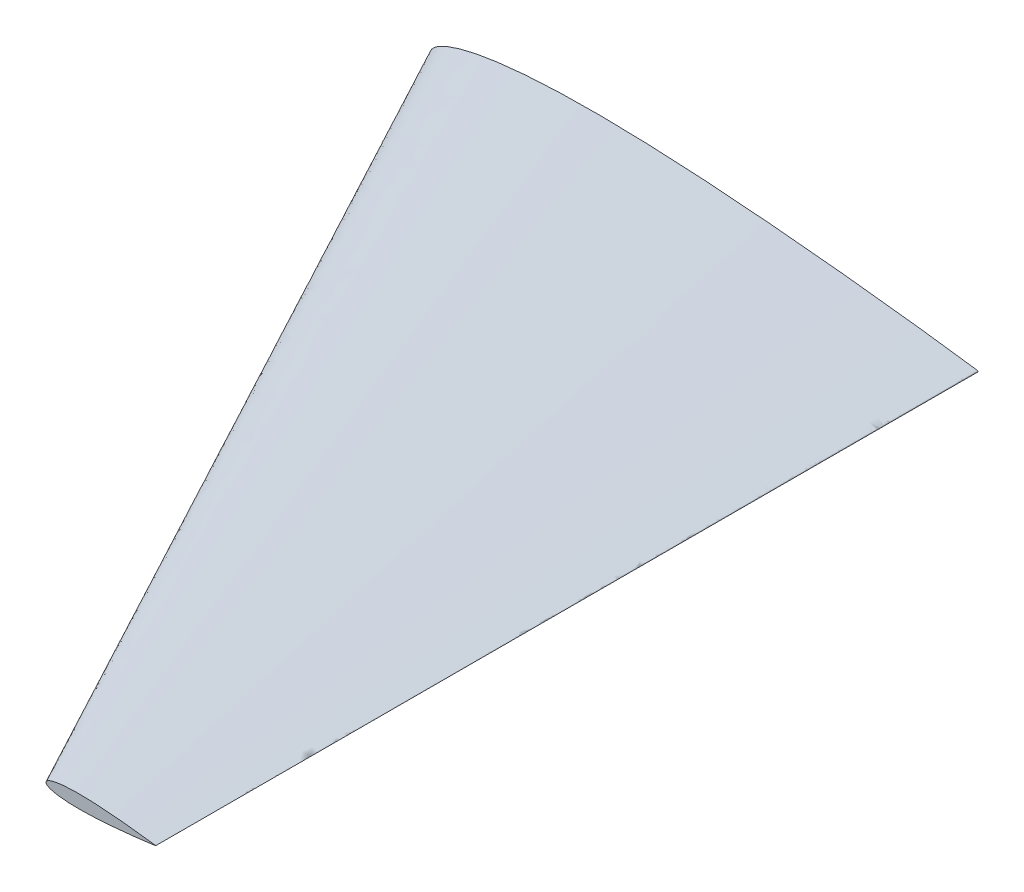
from build123d import *

# Parameters (mm, degrees)
SKETCH4_R          = 3
CUT_EXTRUDE3_DEPTH = 40


with BuildPart() as part:
    # Sketch2 for Loft3 → Loft3 section 0
    with BuildSketch(Plane(origin=(0, 0, 0), x_dir=(0, 1, 0), z_dir=(0, 0, 1))):
        with BuildLine():
            # circular arc as an exact rational Bezier (weights 1, cos(half-angle), 1)
            Bezier((-0.1134, -90), (0, -90.808630182), (0.1134, -90), weights=[1, 0.138878188, 1])
            add(Edge.make_bspline(
                [(0.1134, -90), (0.119883103, -89.953770434), (0.145780197, -89.769104014), (0.203559317, -89.354670505), (0.29903625, -88.666808737), (0.43002961, -87.709721874), (0.595034667, -86.48935693), (0.790717945, -85.013174411), (1.014447537, -83.290291495), (1.262704812, -81.331354624), (1.532156619, -79.148419388), (1.81883068, -76.754947135), (2.119272922, -74.165710303), (2.429361956, -71.396635047), (2.745321108, -68.464808853), (3.063223397, -65.388326514), (3.378966278, -62.186148552), (3.688117442, -58.878026055), (3.986618437, -55.484331913), (4.269478842, -52.026026469), (4.532086612, -48.524359499), (4.769566223, -45.000951756), (4.976952181, -41.477512363), (5.149005142, -37.975732412), (5.281137154, -34.517238785), (5.369037574, -31.123254472), (5.408413012, -27.814753604), (5.396138618, -24.61206555), (5.329843493, -21.534935718), (5.207847127, -18.602305244), (5.029830398, -15.832225033), (4.796328946, -13.241720098), (4.509166427, -10.846642485), (4.17078617, -8.66159096), (3.784722266, -6.699806407), (3.355340044, -4.972787114), (2.886826516, -3.490346755), (2.383545234, -2.260017099), (1.848901134, -1.285721701), (1.281838991, -0.568959771), (0.668640285, -0.109879586), (0, 0.051207794), (-0.668640285, -0.109879586), (-1.281838991, -0.568959771), (-1.848901134, -1.285721701), (-2.383545234, -2.260017099), (-2.886826516, -3.490346755), (-3.355340044, -4.972787114), (-3.784722266, -6.699806407), (-4.17078617, -8.66159096), (-4.509166427, -10.846642485), (-4.796328946, -13.241720098), (-5.029830398, -15.832225033), (-5.207847127, -18.602305244), (-5.329843493, -21.534935718), (-5.396138618, -24.61206555), (-5.408413012, -27.814753604), (-5.369037574, -31.123254472), (-5.281137154, -34.517238785), (-5.149005142, -37.975732412), (-4.976952181, -41.477512363), (-4.769566223, -45.000951756), (-4.532086612, -48.524359499), (-4.269478842, -52.026026469), (-3.986618437, -55.484331913), (-3.688117442, -58.878026055), (-3.378966278, -62.186148552), (-3.063223397, -65.388326514), (-2.745321108, -68.464808853), (-2.429361956, -71.396635047), (-2.119272922, -74.165710303), (-1.81883068, -76.754947135), (-1.532156619, -79.148419388), (-1.262704812, -81.331354624), (-1.014447537, -83.290291495), (-0.790717945, -85.013174411), (-0.595034667, -86.48935693), (-0.43002961, -87.709721874), (-0.29903625, -88.666808737), (-0.203559317, -89.354670505), (-0.145780197, -89.769104014), (-0.119883103, -89.953770434), (-0.1134, -90)],
                knots=[0, 0, 0, 0, 0.000763157, 0.003048469, 0.00684069, 0.012116132, 0.018840792, 0.02697275, 0.036459854, 0.047242945, 0.059253555, 0.072417264, 0.086651022, 0.101866322, 0.117968955, 0.134857919, 0.152428309, 0.170571841, 0.189174522, 0.208122338, 0.227296649, 0.24658007, 0.265853108, 0.284996761, 0.303895242, 0.322432581, 0.340498659, 0.357984483, 0.374788114, 0.390812303, 0.405965006, 0.420162443, 0.433328265, 0.445393603, 0.456301171, 0.466003881, 0.474472001, 0.481696232, 0.487703698, 0.492583405, 0.496543603, 0.5, 0.503456397, 0.507416595, 0.512296302, 0.518303768, 0.525527999, 0.533996119, 0.543698829, 0.554606397, 0.566671735, 0.579837557, 0.594034994, 0.609187697, 0.625211886, 0.642015517, 0.659501341, 0.677567419, 0.696104758, 0.715003239, 0.734146892, 0.75341993, 0.772703351, 0.791877662, 0.810825478, 0.829428159, 0.847571691, 0.865142081, 0.882031045, 0.898133678, 0.913348978, 0.927582736, 0.940746445, 0.952757055, 0.963540146, 0.97302725, 0.981159208, 0.987883868, 0.99315931, 0.996951531, 0.999236843, 1, 1, 1, 1], degree=3))
        make_face()
    # Sketch3 for Loft3 → Loft3 section 1
    with BuildSketch(Plane(origin=(0, 0, 135), x_dir=(0, 1, 0), z_dir=(0, 0, 1))):
        with BuildLine():
            Bezier((-0.02268, -89.987277685), (0, -90.14900372), (0.02268, -89.987277685), weights=[1, 0.138878188, 1])
            add(Edge.make_bspline(
                [(0.02268, -89.987277685), (0.023976621, -89.978031772), (0.029156039, -89.941098488), (0.040711863, -89.858211786), (0.05980725, -89.720639432), (0.086005922, -89.52922206), (0.119006933, -89.285149071), (0.158143589, -88.989912567), (0.202889507, -88.645335984), (0.252540962, -88.25354861), (0.306431324, -87.816961562), (0.363766136, -87.338267112), (0.423854584, -86.820419745), (0.485872391, -86.266604694), (0.549064222, -85.680239456), (0.612644679, -85.064942988), (0.675793256, -84.424507395), (0.759192361, -83.532081652), (0.836875781, -82.61943105), (0.906417322, -81.692149585), (0.953913245, -80.987468036), (0.995390436, -80.282780157), (1.029801028, -79.582424167), (1.056227431, -78.890725442), (1.073807515, -78.211928579), (1.081682602, -77.550228406), (1.079227724, -76.909690795), (1.065968699, -76.294264828), (1.041569425, -75.707738734), (1.00596608, -75.153722691), (0.959265789, -74.635621704), (0.901833285, -74.156606182), (0.834157234, -73.719595877), (0.756944453, -73.327238966), (0.671068009, -72.981835108), (0.577365303, -72.685347036), (0.476709047, -72.439281105), (0.369780227, -72.244422025), (0.256367798, -72.101069639), (0.133728057, -72.009253602), (0, -71.977036126), (-0.133728057, -72.009253602), (-0.256367798, -72.101069639), (-0.369780227, -72.244422025), (-0.476709047, -72.439281105), (-0.577365303, -72.685347036), (-0.671068009, -72.981835108), (-0.756944453, -73.327238966), (-0.834157234, -73.719595877), (-0.901833285, -74.156606182), (-0.959265789, -74.635621704), (-1.00596608, -75.153722691), (-1.041569425, -75.707738734), (-1.065968699, -76.294264828), (-1.079227724, -76.909690795), (-1.081682602, -77.550228406), (-1.073807515, -78.211928579), (-1.056227431, -78.890725442), (-1.029801028, -79.582424167), (-0.995390436, -80.282780157), (-0.953913245, -80.987468036), (-0.906417322, -81.692149585), (-0.836875781, -82.61943105), (-0.759192361, -83.532081652), (-0.675793256, -84.424507395), (-0.612644679, -85.064942988), (-0.549064222, -85.680239456), (-0.485872391, -86.266604694), (-0.423854584, -86.820419745), (-0.363766136, -87.338267112), (-0.306431324, -87.816961562), (-0.252540962, -88.25354861), (-0.202889507, -88.645335984), (-0.158143589, -88.989912567), (-0.119006933, -89.285149071), (-0.086005922, -89.52922206), (-0.05980725, -89.720639432), (-0.040711863, -89.858211786), (-0.029156039, -89.941098488), (-0.023976621, -89.978031772), (-0.02268, -89.987277685)],
                knots=[0, 0, 0, 0, 0.000763157, 0.003048469, 0.00684069, 0.012116132, 0.018840792, 0.02697275, 0.036459854, 0.047242945, 0.059253555, 0.072417264, 0.086651022, 0.101866322, 0.117968955, 0.134857919, 0.152428309, 0.170571841, 0.208122338, 0.227296649, 0.24658007, 0.265853108, 0.284996761, 0.303895242, 0.322432581, 0.340498659, 0.357984483, 0.374788114, 0.390812303, 0.405965006, 0.420162443, 0.433328265, 0.445393603, 0.456301171, 0.466003881, 0.474472001, 0.481696232, 0.487703698, 0.492583405, 0.496543603, 0.5, 0.503456397, 0.507416595, 0.512296302, 0.518303768, 0.525527999, 0.533996119, 0.543698829, 0.554606397, 0.566671735, 0.579837557, 0.594034994, 0.609187697, 0.625211886, 0.642015517, 0.659501341, 0.677567419, 0.696104758, 0.715003239, 0.734146892, 0.75341993, 0.772703351, 0.791877662, 0.829428159, 0.847571691, 0.865142081, 0.882031045, 0.898133678, 0.913348978, 0.927582736, 0.940746445, 0.952757055, 0.963540146, 0.97302725, 0.981159208, 0.987883868, 0.99315931, 0.996951531, 0.999236843, 1, 1, 1, 1], degree=3))
        make_face()
    loft()

    # Sketch4 → Cut-Extrude3 (cut)
    with BuildSketch(Plane(origin=(0, 0, 0), x_dir=(1, 0, 0), z_dir=(0, 0, -1))):
        with Locations((39.984097106, 0)):
            Circle(SKETCH4_R)
    extrude(amount=-CUT_EXTRUDE3_DEPTH, mode=Mode.SUBTRACT)


solid = part.part
